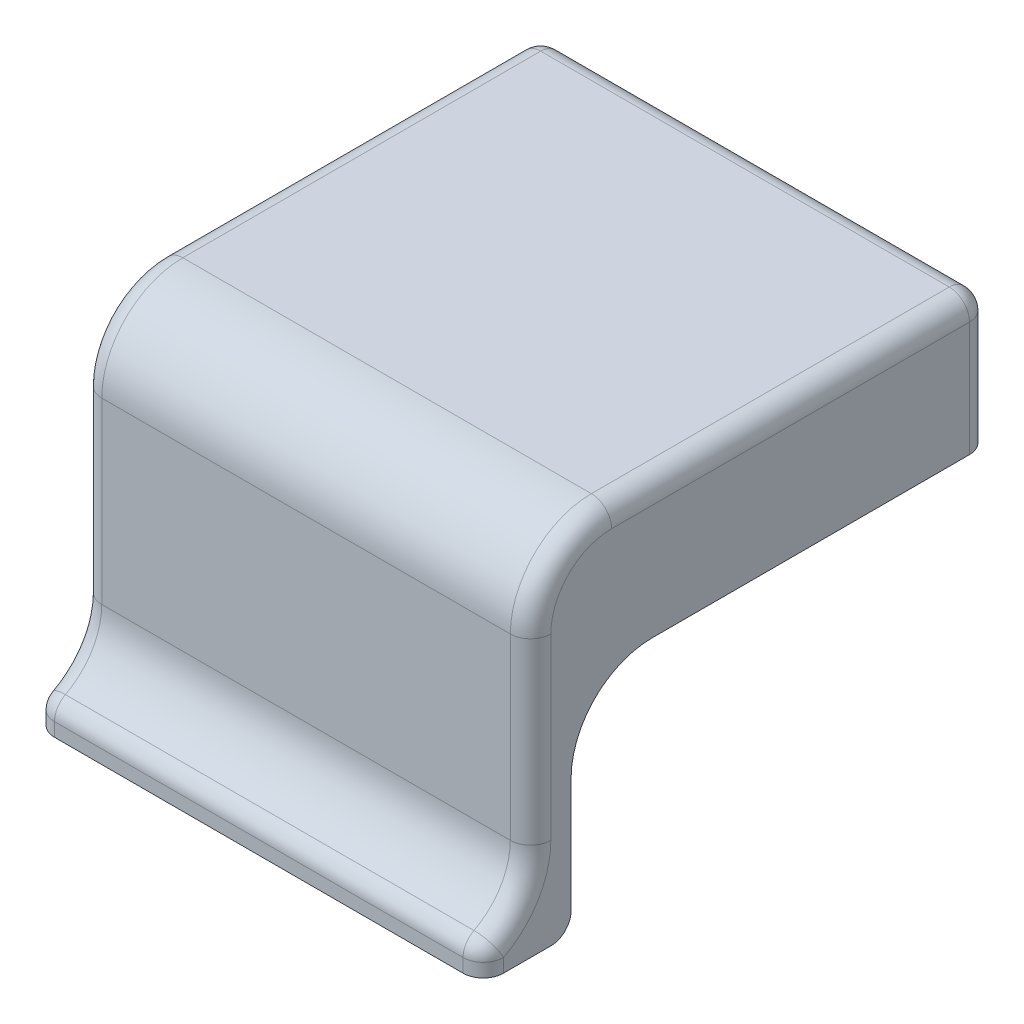
from build123d import *

# Parameters (mm, degrees)
BOSS_EXTRUDE1_DEPTH = 10
SKETCH2_W           = 66.5
SKETCH2_H           = 6
BOSS_EXTRUDE2_DEPTH = 42
BOSS_EXTRUDE3_DEPTH = 10
SKETCH3_R           = 20.035
CUT_EXTRUDE2_DEPTH  = 10
FILLET1_R           = 12
SKETCH7_W           = 66.5
SKETCH7_H           = 4
BOSS_EXTRUDE4_DEPTH = 7
SKETCH8_R           = 3.025
CUT_EXTRUDE3_DEPTH  = 3
FILLET2_R           = 12
FILLET3_R           = 10
FILLET4_R           = 3
FILLET5_R           = 3


with BuildPart() as part:
    # Sketch1 → Boss-Extrude1 (new body)
    with BuildSketch(Plane(origin=(0, 0, 0), x_dir=(1, 0, 0), z_dir=(0, 1, 0))):
        Polygon((0, 0), (-43.5, 0), (-43.5, -68), (23, -68), (23, 0), align=None)
    extrude(amount=BOSS_EXTRUDE1_DEPTH)

    # Sketch2 → Boss-Extrude2 (add)
    with BuildSketch(Plane.XZ):
        with Locations((-10.25, 65)):
            Rectangle(SKETCH2_W, SKETCH2_H)
    extrude(amount=BOSS_EXTRUDE2_DEPTH)

    # Sketch4 → Boss-Extrude3 (add)
    with BuildSketch(Plane.XZ):
        Polygon((-43.5, 62), (-36, 62), (-36, 7.5), (15.5, 7.5), (15.5, 62), (23, 62), (23, 0), (-43.5, 0), align=None)
    extrude(amount=BOSS_EXTRUDE3_DEPTH)

    # Sketch3 → Cut-Extrude2 (cut)
    with BuildSketch(Plane(origin=(0, 0, 0), x_dir=(-1, 0, 0), z_dir=(0, 0, -1))):
        with Locations((16, -22)):
            Circle(SKETCH3_R)
    extrude(amount=-CUT_EXTRUDE2_DEPTH, mode=Mode.SUBTRACT)

    # Fillet1
    fillet1_edges = [part.edges().sort_by_distance(p)[0] for p in [
        (19.25, -10, 62),
        (-39.75, -10, 62),
    ]]
    fillet(fillet1_edges, radius=FILLET1_R)

    # Sketch7 → Boss-Extrude4 (add)
    with BuildSketch(Plane.XY.offset(68)):
        with Locations((-10.25, -40)):
            Rectangle(SKETCH7_W, SKETCH7_H)
    extrude(amount=BOSS_EXTRUDE4_DEPTH)

    # Sketch8 → Cut-Extrude3 (cut)
    with BuildSketch(Plane.XZ.offset(42)):
        with Locations(Location((-28.5, 67, 0), (0, 0, 270))):
            Circle(SKETCH8_R)
        with Locations(Location((3, 67, 0), (0, 0, 270))):
            Circle(SKETCH8_R)
    extrude(amount=-CUT_EXTRUDE3_DEPTH, mode=Mode.SUBTRACT)

    # Fillet2
    fillet2_edges = [part.edges().sort_by_distance(p)[0] for p in [
        (-10.25, 10, 68),
    ]]
    fillet(fillet2_edges, radius=FILLET2_R)

    # Fillet3
    # the kernel refuses this fillet: 10 mm, written as the material it adds along each edge
    with BuildSketch(Plane(origin=(23, -38, 68), x_dir=(0, 1, 0), z_dir=(-1, 0, 0))) as fillet3_piece_1:
        with BuildLine():
            CenterArc((9.539392014, -10), FILLET3_R, 90, 72.542396876)
            Line((0, -7), (-0.19078784, -6.94))
            ThreePointArc((-0.19078784, -6.94), (-0.2, -3.5), (-0.2, 0))
            Line((-0.2, 0), (0, 0.2))
            Line((0, 0.2), (9.539392014, 0.2))
            Line((9.539392014, 0.2), (9.539392014, 0))
        make_face()
    extrude(amount=66.5)

    # Fillet4
    # the kernel refuses this fillet: 3 mm, written as the material it takes off along each edge
    with BuildSketch(Plane(origin=(-51, -42, 62), x_dir=(0, 0, 1), z_dir=(1, 0, 0))) as fillet4_piece_1:
        with BuildLine():
            CenterArc((FILLET4_R, -FILLET4_R), FILLET4_R, 90, 90)
            Line((0, -FILLET4_R), (0, 0))
            Line((0, 0), (FILLET4_R, 0))
        make_face()
    extrude(amount=81.5, mode=Mode.SUBTRACT)

    # Fillet5
    fillet5_edges = [part.edges().sort_by_distance(p)[0] for p in [
        (23, 10, 28),
        (23, -15.230303993, 68),
        (23, 6.485281374, 64.485281374),
        (-43.5, -15.230303993, 68),
        (-43.5, 6.485281374, 64.485281374),
        (-43.5, -34.376687769, 69.937742252),
        (23, -34.376687769, 69.937742252),
        (-43.5, 10, 28),
        (-10.25, 10, 0),
        (-43.5, -40, 75),
        (23, -40, 75),
        (23, 0, 0),
        (-10.25, -38, 75),
        (-43.5, 0, 0),
    ]]
    fillet(fillet5_edges, radius=FILLET5_R)


solid = part.part
